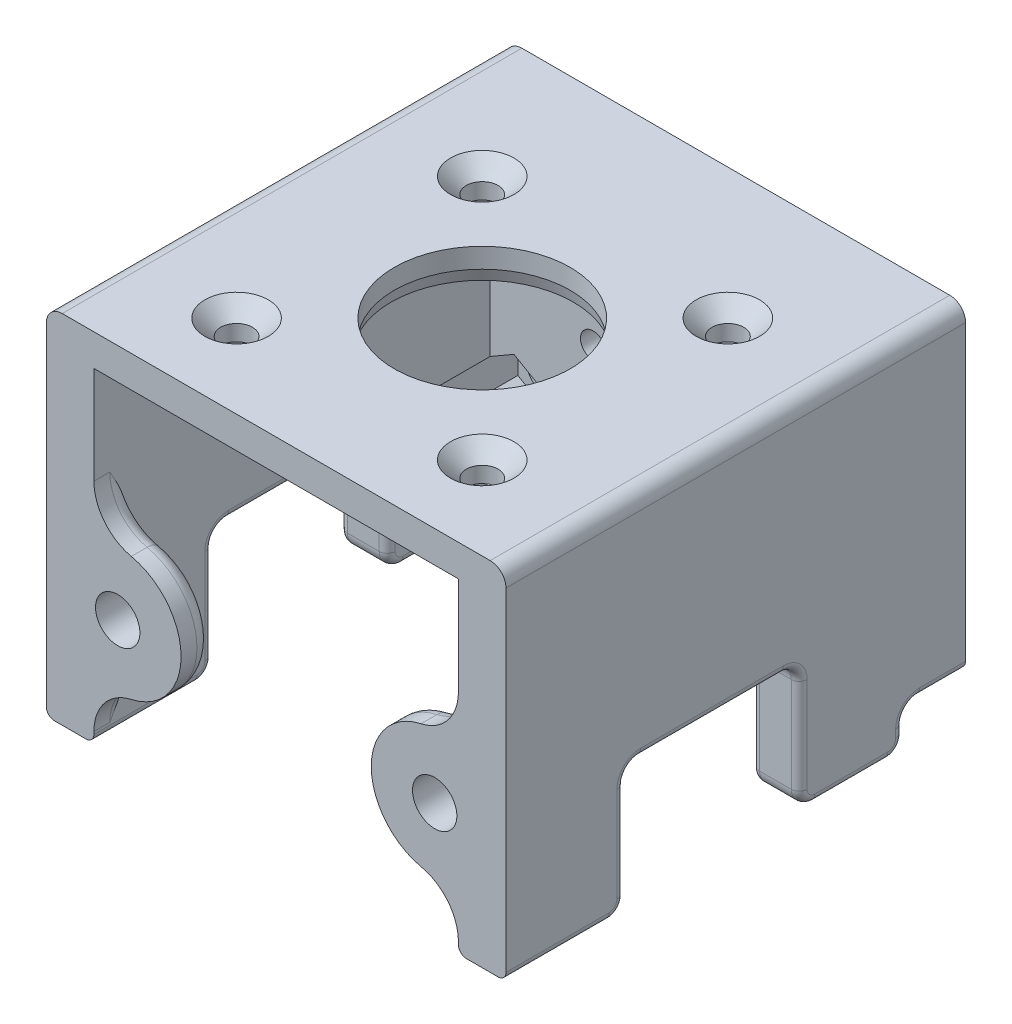
from build123d import *
from OCP.BRepFilletAPI import BRepFilletAPI_MakeChamfer

# Parameters (mm, degrees)
SKIZZE1_W                            = 58
SKIZZE1_H                            = 40
SKIZZE1_R                            = 2.4
SKIZZE1_R_2                          = 1.6
AUFSATZ_LINEAR_AUSTRAGEN1_DEPTH      = 8
AUFSATZ_LINEAR_AUSTRAGEN2_DEPTH      = 50
SKIZZE5_R                            = 11.1
SKIZZE5_R_2                          = 2
SCHNITT_LINEAR_AUSTRAGEN1_DEPTH      = 8
FASE1_SIZE                           = 2
SCHNITT_LINEAR_AUSTRAGEN6_DEPTH      = 10
SCHNITT_LINEAR_AUSTRAGEN6_DEPTH_BACK = 4
SKIZZE10_R                           = 8
SKIZZE10_R_2                         = 2.8
AUFSATZ_LINEAR_AUSTRAGEN3_DEPTH      = 4
SKIZZE13_W                           = 6
SKIZZE13_H                           = 50.174433159
AUFSATZ_LINEAR_AUSTRAGEN4_DEPTH      = 5
VERRUNDUNG1_R                        = 6
VERRUNDUNG3_R                        = 2
SKIZZE11_R                           = 2.8
SCHNITT_LINEAR_AUSTRAGEN7_DEPTH      = 4
FASE3_SIZE                           = 0.4
FASE3_SIZE2                          = 1.492820323
SKIZZE7_R                            = 2.4
SCHNITT_LINEAR_AUSTRAGEN2_DEPTH      = 18
VERRUNDUNG4_R                        = 2
SKIZZE12_W                           = 58
SKIZZE12_H                           = 22
SCHNITT_LINEAR_AUSTRAGEN8_DEPTH      = 16
VERRUNDUNG5_R                        = 2
FASE4_SIZE                           = 4.5
FASE4_SIZE2                          = 1.205771366
LINEARES_MUSTER1_COUNT               = 2
LINEARES_MUSTER1_PITCH               = 52
VERRUNDUNG6_R                        = 1


# Read off the part's stored shape, not the designer's step: Aufsatz-Linear austragen2
with BuildPart() as part:
    # Skizze1 → Aufsatz-Linear austragen1 (new body)
    with BuildSketch(Plane.XY):
        with Locations((0, -20)):
            Rectangle(SKIZZE1_W, SKIZZE1_H)
        with Locations((-20, -10)):
            Circle(SKIZZE1_R, mode=Mode.SUBTRACT)
        with Locations((0, -10)):
            Circle(SKIZZE1_R, mode=Mode.SUBTRACT)
        with Locations((20, -10)):
            Circle(SKIZZE1_R, mode=Mode.SUBTRACT)
        with Locations((0, -30)):
            Circle(SKIZZE1_R, mode=Mode.SUBTRACT)
        with Locations((20, -30)):
            Circle(SKIZZE1_R, mode=Mode.SUBTRACT)
        with Locations((-20, -30)):
            Circle(SKIZZE1_R, mode=Mode.SUBTRACT)
        with Locations((-10, -20)):
            Circle(SKIZZE1_R_2, mode=Mode.SUBTRACT)
        with Locations((10, -20)):
            Circle(SKIZZE1_R_2, mode=Mode.SUBTRACT)
    extrude(amount=AUFSATZ_LINEAR_AUSTRAGEN1_DEPTH)

    # Aufsatz-Linear austragen2 outline → Aufsatz-Linear austragen2 (add)
    with BuildSketch(Plane.XY.offset(8)):
        Polygon((23, -40), (29, -40), (29, 0), (-29, 0), (-29, -40), (-23, -40), (-23, -4), (23, -4), align=None)
    extrude(amount=AUFSATZ_LINEAR_AUSTRAGEN2_DEPTH)

    # Skizze5 → Schnitt-Linear austragen1 (cut)
    with BuildSketch(Plane(origin=(0, 0, 0), x_dir=(1, 0, 0), z_dir=(0, 1, 0))):
        with Locations(Location((0, -32, 0), (0, 0, 180))):
            Circle(SKIZZE5_R)
        with Locations(Location((-15.5, -16.5, 0), (0, 0, 180))):
            Circle(SKIZZE5_R_2)
        with Locations(Location((15.5, -16.5, 0), (0, 0, 180))):
            Circle(SKIZZE5_R_2)
        with Locations(Location((15.5, -47.5, 0), (0, 0, 180))):
            Circle(SKIZZE5_R_2)
        with Locations(Location((-15.5, -47.5, 0), (0, 0, 180))):
            Circle(SKIZZE5_R_2)
    extrude(amount=-SCHNITT_LINEAR_AUSTRAGEN1_DEPTH, mode=Mode.SUBTRACT)

    # Fase1
    fase1_edges = [part.edges().sort_by_distance(p)[0] for p in [
        (-13.5, 0, 47.5),
        (17.5, 0, 47.5),
        (17.5, 0, 16.5),
        (-13.5, 0, 16.5),
    ]]
    chamfer(fase1_edges, length=FASE1_SIZE)

    # Skizze9 → Schnitt-Linear austragen6 (cut, two sides: drawn at the far end of the back side and taken through both)
    with BuildSketch(Plane.XY.offset(8).offset(-SCHNITT_LINEAR_AUSTRAGEN6_DEPTH_BACK)):
        Polygon((3.5, -7.979274058), (0, -5.958548116), (-3.5, -7.979274058), (-3.5, -12.020725942), (0, -14.041451884), (3.5, -12.020725942), align=None)
        Polygon((-16.5, -7.979274058), (-20, -5.958548116), (-23.5, -7.979274058), (-23.5, -12.020725942), (-20, -14.041451884), (-16.5, -12.020725942), align=None)
        Polygon((23.5, -7.979274058), (20, -5.958548116), (16.5, -7.979274058), (16.5, -12.020725942), (20, -14.041451884), (23.5, -12.020725942), align=None)
        Polygon((3.5, -27.979274058), (0, -25.958548116), (-3.5, -27.979274058), (-3.5, -32.020725942), (0, -34.041451884), (3.5, -32.020725942), align=None)
        Polygon((23.5, -27.979274058), (20, -25.958548116), (16.5, -27.979274058), (16.5, -32.020725942), (20, -34.041451884), (23.5, -32.020725942), align=None)
        Polygon((-16.5, -27.979274058), (-20, -25.958548116), (-23.5, -27.979274058), (-23.5, -32.020725942), (-20, -34.041451884), (-16.5, -32.020725942), align=None)
    extrude(amount=SCHNITT_LINEAR_AUSTRAGEN6_DEPTH + SCHNITT_LINEAR_AUSTRAGEN6_DEPTH_BACK, mode=Mode.SUBTRACT)

    # Skizze10 → Aufsatz-Linear austragen3 (add)
    # profile 1 of 2: a face of its own
    with BuildSketch(Plane.XY.offset(58)):
        with Locations((20, -30)):
            Circle(SKIZZE10_R)
    # profile 2 of 2: a face of its own
    with BuildSketch(Plane.XY.offset(58)):
        with Locations((-20, -30)):
            Circle(SKIZZE10_R)
        with Locations((-20, -30)):
            Circle(SKIZZE10_R_2, mode=Mode.SUBTRACT)
    extrude(amount=-AUFSATZ_LINEAR_AUSTRAGEN3_DEPTH)

    # Skizze13 → Aufsatz-Linear austragen4 (add)
    with BuildSketch(Plane.XZ.offset(40)):
        with Locations((-26, 32.912783421)):
            Rectangle(SKIZZE13_W, SKIZZE13_H)
        with Locations((26, 32.912783421)):
            Rectangle(SKIZZE13_W, SKIZZE13_H)
    extrude(amount=AUFSATZ_LINEAR_AUSTRAGEN4_DEPTH)

    # Verrundung1
    verrundung1_edges = [part.edges().sort_by_distance(p)[0] for p in [
        (23, -37.416198487, 56),
        (23, -22.583801513, 56),
        (-23, -37.416198487, 56),
        (-23, -22.583801513, 56),
    ]]
    fillet(verrundung1_edges, radius=VERRUNDUNG1_R)

    # Verrundung3
    # the kernel refuses this fillet: 2 mm, written as the material it takes off along each edge
    with BuildSketch(Plane(origin=(-20, -30, 54), x_dir=(0.21428571428571433, -0.9767710236555245, 0), z_dir=(-0.9767710236555245, -0.21428571428571433, 0))) as verrundung3_piece_1:
        with BuildLine():
            CenterArc((8 - VERRUNDUNG3_R, VERRUNDUNG3_R), VERRUNDUNG3_R, 270, 90)
            Line((8 - VERRUNDUNG3_R, 0), (8, 0))
            Line((8, 0), (8, VERRUNDUNG3_R))
        make_face()
    revolve(axis=Axis((-20, -30, 54), (0, 0, 1)), revolution_arc=155.252749768, mode=Mode.SUBTRACT)
    with BuildSketch(Plane(origin=(20, -30, 54), x_dir=(-0.21428571428571433, 0.9767710236555245, 0), z_dir=(0.9767710236555245, 0.21428571428571433, 0))) as verrundung3_piece_2:
        with BuildLine():
            CenterArc((8 - VERRUNDUNG3_R, VERRUNDUNG3_R), VERRUNDUNG3_R, 270, 90)
            Line((8 - VERRUNDUNG3_R, 0), (8, 0))
            Line((8, 0), (8, VERRUNDUNG3_R))
        make_face()
    revolve(axis=Axis((20, -30, 54), (0, 0, 1)), revolution_arc=155.252749768, mode=Mode.SUBTRACT)
    with BuildSketch(Plane(origin=(-17, -16.325205669, 54), x_dir=(-0.6722279054593165, 0.7403442733767718, 0), z_dir=(0.7403442733767718, 0.6722279054593165, 0))) as verrundung3_piece_3_section:
        with BuildLine():
            CenterArc((6 + VERRUNDUNG3_R, VERRUNDUNG3_R), VERRUNDUNG3_R, 180, 90)
            Line((6 + VERRUNDUNG3_R, 0), (6, 0))
            Line((6, 0), (6, VERRUNDUNG3_R))
        make_face()
    verrundung3_piece_3 = revolve(axis=Axis((-17, -16.325205669, 54), (0, 0, 1)), revolution_arc=125.387125524, mode=Mode.PRIVATE)
    verrundung3_piece_3 = split(verrundung3_piece_3, bisect_by=Plane(origin=(-23, -20.355034942, 54.516064296), z_dir=(1, 0, 0)), keep=Keep.TOP, mode=Mode.PRIVATE)
    add(verrundung3_piece_3, mode=Mode.SUBTRACT)
    with BuildSketch(Plane(origin=(-17, -43.674794331, 54), x_dir=(-0.6722279054593165, -0.7403442733767718, 0), z_dir=(0.7403442733767718, -0.6722279054593165, 0))) as verrundung3_piece_4_section:
        with BuildLine():
            CenterArc((6 + VERRUNDUNG3_R, -VERRUNDUNG3_R), VERRUNDUNG3_R, 90, 90)
            Line((6, -VERRUNDUNG3_R), (6, 0))
            Line((6, 0), (6 + VERRUNDUNG3_R, 0))
        make_face()
    verrundung3_piece_4 = revolve(axis=Axis((-17, -43.674794331, 54), (0, 0, -1)), revolution_arc=125.387125524, mode=Mode.PRIVATE)
    verrundung3_piece_4 = split(verrundung3_piece_4, bisect_by=Plane(origin=(-23, -39.644965239, 54.51606418), z_dir=(1, 0, 0)), keep=Keep.TOP, mode=Mode.PRIVATE)
    add(verrundung3_piece_4, mode=Mode.SUBTRACT)
    with BuildSketch(Plane(origin=(17, -43.674794331, 54), x_dir=(0.6722279054593165, -0.7403442733767718, 0), z_dir=(-0.7403442733767718, -0.6722279054593165, 0))) as verrundung3_piece_5_section:
        with BuildLine():
            CenterArc((6 + VERRUNDUNG3_R, VERRUNDUNG3_R), VERRUNDUNG3_R, 180, 90)
            Line((6 + VERRUNDUNG3_R, 0), (6, 0))
            Line((6, 0), (6, VERRUNDUNG3_R))
        make_face()
    verrundung3_piece_5 = revolve(axis=Axis((17, -43.674794331, 54), (0, 0, 1)), revolution_arc=125.387125524, mode=Mode.PRIVATE)
    verrundung3_piece_5 = split(verrundung3_piece_5, bisect_by=Plane(origin=(23, -39.644963205, 54.516060737), z_dir=(-1, 0, 0)), keep=Keep.TOP, mode=Mode.PRIVATE)
    add(verrundung3_piece_5, mode=Mode.SUBTRACT)
    with BuildSketch(Plane(origin=(17, -16.325205669, 54), x_dir=(0.672227905459316, 0.7403442733767723, 0), z_dir=(-0.7403442733767723, 0.672227905459316, 0))) as verrundung3_piece_6_section:
        with BuildLine():
            CenterArc((6 + VERRUNDUNG3_R, -VERRUNDUNG3_R), VERRUNDUNG3_R, 90, 90)
            Line((6, -VERRUNDUNG3_R), (6, 0))
            Line((6, 0), (6 + VERRUNDUNG3_R, 0))
        make_face()
    verrundung3_piece_6 = revolve(axis=Axis((17, -16.325205669, 54), (0, 0, -1)), revolution_arc=125.387125524, mode=Mode.PRIVATE)
    verrundung3_piece_6 = split(verrundung3_piece_6, bisect_by=Plane(origin=(23, -20.355037546, 54.516064213), z_dir=(-1, 0, 0)), keep=Keep.TOP, mode=Mode.PRIVATE)
    add(verrundung3_piece_6, mode=Mode.SUBTRACT)

    # Skizze11 → Schnitt-Linear austragen7 (cut)
    with BuildSketch(Plane.XY.offset(58)):
        with Locations((20, -30)):
            Circle(SKIZZE11_R)
    extrude(amount=-SCHNITT_LINEAR_AUSTRAGEN7_DEPTH, mode=Mode.SUBTRACT)

    # Fase3
    fase3_edges = [part.edges().sort_by_distance(p)[0] for p in [
        (11.1, -4, 32),
    ]]
    fase3_side = [part.faces().sort_by_distance(p)[0] for p in [
        (-22.32058849, -4, 33),
    ]]
    chamfer(fase3_edges, length=FASE3_SIZE, length2=FASE3_SIZE2, reference=fase3_side[0])

    # Skizze7 → Schnitt-Linear austragen2 (cut)
    with BuildSketch(Plane.XZ.offset(45)):
        with Locations(Location((26, 15.300827002, 0), (0, 0, 270))):
            Circle(SKIZZE7_R)
        with Locations(Location((26, 50.800827002, 0), (0, 0, 270))):
            Circle(SKIZZE7_R)
    schnitt_linear_austragen2 = extrude(amount=-SCHNITT_LINEAR_AUSTRAGEN2_DEPTH, mode=Mode.SUBTRACT)

    # Verrundung4
    verrundung4_edges = [part.edges().sort_by_distance(p)[0] for p in [
        (-29, 0, 29),
        (29, 0, 29),
    ]]
    fillet(verrundung4_edges, radius=VERRUNDUNG4_R)

    # Skizze12 → Schnitt-Linear austragen8 (cut)
    with BuildSketch(Plane.XZ.offset(45)):
        with Locations((0, 32)):
            Rectangle(SKIZZE12_W, SKIZZE12_H)
    extrude(amount=-SCHNITT_LINEAR_AUSTRAGEN8_DEPTH, mode=Mode.SUBTRACT)

    # Verrundung5
    verrundung5_edges = [part.edges().sort_by_distance(p)[0] for p in [
        (-26, -40, 7.825566841),
        (-26, -45, 7.825566841),
        (26, -40, 7.825566841),
        (26, -45, 7.825566841),
        (26, -45, 21),
        (-26, -45, 21),
        (-26, -45, 43),
        (-26, -29, 43),
        (-26, -29, 21),
        (26, -29, 43),
        (26, -29, 21),
        (26, -45, 43),
    ]]
    fillet(verrundung5_edges, radius=VERRUNDUNG5_R)

    # Fase4: one chamfer whose edges measure the first distance from different faces: ONE call of the kernel's chamfer builder (chamfer() names one face for all edges)
    fase4_edges_1 = [part.edges().sort_by_distance(p)[0] for p in [
        (-11.6, -20, 0),
    ]]
    fase4_side_1 = [part.faces().sort_by_distance(p)[0] for p in [
        (-11.6, -20, 4),
    ]]
    fase4_edges_2 = [part.edges().sort_by_distance(p)[0] for p in [
        (8.4, -20, 0),
    ]]
    fase4_side_2 = [part.faces().sort_by_distance(p)[0] for p in [
        (8.4, -20, 4),
    ]]
    fase4 = BRepFilletAPI_MakeChamfer(part.part.solid().wrapped)
    for e in fase4_edges_1:
        fase4.Add(FASE4_SIZE, FASE4_SIZE2, e.wrapped, fase4_side_1[0].wrapped)  # the first distance lies on this face
    for e in fase4_edges_2:
        fase4.Add(FASE4_SIZE, FASE4_SIZE2, e.wrapped, fase4_side_2[0].wrapped)  # the first distance lies on this face
    add(Compound.cast(fase4.Shape()), mode=Mode.REPLACE)

    # Lineares Muster1: Schnitt-Linear austragen2 ×2
    with Locations(*[(-i * LINEARES_MUSTER1_PITCH, 0, 0) for i in range(1, LINEARES_MUSTER1_COUNT)]):
        add(schnitt_linear_austragen2, mode=Mode.SUBTRACT)

    # Verrundung6
    # the kernel refuses this fillet: 1 mm, written as the material it takes off along each edge
    with BuildSketch(Plane(origin=(-23, -42, 5.825566841), x_dir=(0, 0.3148458040869784, -0.9491428341660828), z_dir=(0, -0.9491428341660828, -0.3148458040869784))) as verrundung6_piece_1_section:
        with BuildLine():
            CenterArc((2 + VERRUNDUNG6_R, -VERRUNDUNG6_R), VERRUNDUNG6_R, 90, 90)
            Line((2, -VERRUNDUNG6_R), (2, 0))
            Line((2, 0), (2 + VERRUNDUNG6_R, 0))
        make_face()
    verrundung6_piece_1 = revolve(axis=Axis((-23, -42, 5.825566841), (1, 0, 0)), revolution_arc=161.648494619, mode=Mode.PRIVATE)
    verrundung6_piece_1 = split(verrundung6_piece_1, bisect_by=Plane(origin=(-23.272151062, -40, 7.287763131), z_dir=(0, -1, 0)), keep=Keep.TOP, mode=Mode.PRIVATE)
    add(verrundung6_piece_1, mode=Mode.SUBTRACT)
    with BuildSketch(Plane(origin=(-23, -42, 5.825566841), x_dir=(0, 0.3148458040869784, -0.9491428341660828), z_dir=(0, -0.9491428341660828, -0.3148458040869784))) as verrundung6_piece_2_section:
        with BuildLine():
            CenterArc((2 + VERRUNDUNG6_R, -VERRUNDUNG6_R), VERRUNDUNG6_R, 90, 90)
            Line((2, -VERRUNDUNG6_R), (2, 0))
            Line((2, 0), (2 + VERRUNDUNG6_R, 0))
        make_face()
    verrundung6_piece_2 = revolve(axis=Axis((-23, -42, 5.825566841), (1, 0, 0)), revolution_arc=161.648494619, mode=Mode.PRIVATE)
    verrundung6_piece_2 = split(verrundung6_piece_2, bisect_by=Plane(origin=(-23.00020869, -39.986552232, 8), z_dir=(0, 0, 1)), keep=Keep.TOP, mode=Mode.PRIVATE)
    add(verrundung6_piece_2, mode=Mode.SUBTRACT)
    with BuildSketch(Plane(origin=(-23, -42, 7.825566841), x_dir=(0, 0, 1), z_dir=(0, -1, 0)), Plane(origin=(29, -42, 7.825566841), x_dir=(0, 0, 1), z_dir=(0, -1, 0))) as verrundung6_piece_3:
        with BuildLine():
            CenterArc((VERRUNDUNG6_R, VERRUNDUNG6_R), VERRUNDUNG6_R, 180, 90)
            Line((0, VERRUNDUNG6_R), (0, 0))
            Line((0, 0), (VERRUNDUNG6_R, 0))
        make_face()
    extrude(amount=1, mode=Mode.SUBTRACT)
    with BuildSketch(Plane(origin=(-23, -43, 9.825566841), x_dir=(0, -1, 0), z_dir=(0, 0, 1))) as verrundung6_piece_4:
        with BuildLine():
            CenterArc((2 - VERRUNDUNG6_R, -VERRUNDUNG6_R), VERRUNDUNG6_R, 0, 90)
            Line((2, -VERRUNDUNG6_R), (2, 0))
            Line((2, 0), (2 - VERRUNDUNG6_R, 0))
        make_face()
    revolve(axis=Axis((-23, -43, 9.825566841), (1, 0, 0)), revolution_arc=90, mode=Mode.SUBTRACT)
    with BuildSketch(Plane(origin=(-23, -45, 9.825566841), x_dir=(0, 1, 0), z_dir=(0, 0, 1))) as verrundung6_piece_5:
        with BuildLine():
            CenterArc((VERRUNDUNG6_R, VERRUNDUNG6_R), VERRUNDUNG6_R, 180, 90)
            Line((0, VERRUNDUNG6_R), (0, 0))
            Line((0, 0), (VERRUNDUNG6_R, 0))
        make_face()
    extrude(amount=9.174433159, mode=Mode.SUBTRACT)
    with BuildSketch(Plane(origin=(-23, -43, 19), x_dir=(0, 0, 1), z_dir=(0, 1, 0))) as verrundung6_piece_6:
        with BuildLine():
            CenterArc((2 - VERRUNDUNG6_R, -VERRUNDUNG6_R), VERRUNDUNG6_R, 0, 90)
            Line((2, -VERRUNDUNG6_R), (2, 0))
            Line((2, 0), (2 - VERRUNDUNG6_R, 0))
        make_face()
    revolve(axis=Axis((-23, -43, 19), (1, 0, 0)), revolution_arc=90, mode=Mode.SUBTRACT)
    with BuildSketch(Plane(origin=(-23, -43, 21), x_dir=(0, 0, -1), z_dir=(0, 1, 0)), Plane(origin=(-23, -31, 43), x_dir=(0, 0, 1), z_dir=(0, -1, 0)), Plane(origin=(-29, -43, 43), x_dir=(0, 0, 1), z_dir=(0, 1, 0)), Plane(origin=(23, -31, 21), x_dir=(0, 0, -1), z_dir=(0, -1, 0)), Plane(origin=(23, -43, 43), x_dir=(0, 0, 1), z_dir=(0, 1, 0)), Plane(origin=(29, -43, 21), x_dir=(0, 0, -1), z_dir=(0, 1, 0))) as verrundung6_piece_7:
        with BuildLine():
            CenterArc((VERRUNDUNG6_R, VERRUNDUNG6_R), VERRUNDUNG6_R, 180, 90)
            Line((0, VERRUNDUNG6_R), (0, 0))
            Line((0, 0), (VERRUNDUNG6_R, 0))
        make_face()
    extrude(amount=12, mode=Mode.SUBTRACT)
    with BuildSketch(Plane(origin=(-23, -31, 23), x_dir=(0, 1, 0), z_dir=(0, 0, 1))) as verrundung6_piece_8:
        with BuildLine():
            CenterArc((2 + VERRUNDUNG6_R, VERRUNDUNG6_R), VERRUNDUNG6_R, 180, 90)
            Line((2, VERRUNDUNG6_R), (2, 0))
            Line((2, 0), (2 + VERRUNDUNG6_R, 0))
        make_face()
    revolve(axis=Axis((-23, -31, 23), (-1, 0, 0)), revolution_arc=90, mode=Mode.SUBTRACT)
    with BuildSketch(Plane(origin=(-23, -29, 41), x_dir=(0, 1, 0), z_dir=(0, 0, -1)), Plane(origin=(-29, -29, 23), x_dir=(0, 1, 0), z_dir=(0, 0, 1)), Plane(origin=(23, -29, 23), x_dir=(0, 1, 0), z_dir=(0, 0, 1)), Plane(origin=(29, -29, 41), x_dir=(0, 1, 0), z_dir=(0, 0, -1))) as verrundung6_piece_9:
        with BuildLine():
            CenterArc((VERRUNDUNG6_R, -VERRUNDUNG6_R), VERRUNDUNG6_R, 90, 90)
            Line((0, -VERRUNDUNG6_R), (0, 0))
            Line((0, 0), (VERRUNDUNG6_R, 0))
        make_face()
    extrude(amount=18, mode=Mode.SUBTRACT)
    with BuildSketch(Plane(origin=(-23, -31, 41), x_dir=(0, 0, 1), z_dir=(0, -1, 0))) as verrundung6_piece_10:
        with BuildLine():
            CenterArc((2 + VERRUNDUNG6_R, VERRUNDUNG6_R), VERRUNDUNG6_R, 180, 90)
            Line((2, VERRUNDUNG6_R), (2, 0))
            Line((2, 0), (2 + VERRUNDUNG6_R, 0))
        make_face()
    revolve(axis=Axis((-23, -31, 41), (-1, 0, 0)), revolution_arc=90, mode=Mode.SUBTRACT)
    with BuildSketch(Plane(origin=(-23, -43, 45), x_dir=(0, -1, 0), z_dir=(0, 0, 1))) as verrundung6_piece_11:
        with BuildLine():
            CenterArc((2 - VERRUNDUNG6_R, -VERRUNDUNG6_R), VERRUNDUNG6_R, 0, 90)
            Line((2, -VERRUNDUNG6_R), (2, 0))
            Line((2, 0), (2 - VERRUNDUNG6_R, 0))
        make_face()
    revolve(axis=Axis((-23, -43, 45), (1, 0, 0)), revolution_arc=90, mode=Mode.SUBTRACT)
    with BuildSketch(Plane(origin=(-29, -40, -2.5), x_dir=(1, 0, 0), z_dir=(0, 0, 1)), Plane(origin=(29, -40, 5.825566841), x_dir=(-1, 0, 0), z_dir=(0, 0, -1))) as verrundung6_piece_12:
        with BuildLine():
            CenterArc((VERRUNDUNG6_R, VERRUNDUNG6_R), VERRUNDUNG6_R, 180, 90)
            Line((0, VERRUNDUNG6_R), (0, 0))
            Line((0, 0), (VERRUNDUNG6_R, 0))
        make_face()
    extrude(amount=8.325566841, mode=Mode.SUBTRACT)
    with BuildSketch(Plane(origin=(-29, -42, 5.825566841), x_dir=(0, 1, 0), z_dir=(0, 0, -1))) as verrundung6_piece_13:
        with BuildLine():
            CenterArc((2 + VERRUNDUNG6_R, VERRUNDUNG6_R), VERRUNDUNG6_R, 180, 90)
            Line((2, VERRUNDUNG6_R), (2, 0))
            Line((2, 0), (2 + VERRUNDUNG6_R, 0))
        make_face()
    revolve(axis=Axis((-29, -42, 5.825566841), (1, 0, 0)), revolution_arc=90, mode=Mode.SUBTRACT)
    with BuildSketch(Plane(origin=(-29, -42, 7.825566841), x_dir=(0, 0, 1), z_dir=(0, -1, 0)), Plane(origin=(23, -42, 7.825566841), x_dir=(0, 0, 1), z_dir=(0, -1, 0))) as verrundung6_piece_14:
        with BuildLine():
            CenterArc((VERRUNDUNG6_R, -VERRUNDUNG6_R), VERRUNDUNG6_R, 90, 90)
            Line((0, -VERRUNDUNG6_R), (0, 0))
            Line((0, 0), (VERRUNDUNG6_R, 0))
        make_face()
    extrude(amount=1, mode=Mode.SUBTRACT)
    with BuildSketch(Plane(origin=(-29, -43, 9.825566841), x_dir=(0, -1, 0), z_dir=(0, 0, 1))) as verrundung6_piece_15:
        with BuildLine():
            CenterArc((2 - VERRUNDUNG6_R, VERRUNDUNG6_R), VERRUNDUNG6_R, 270, 90)
            Line((2, VERRUNDUNG6_R), (2, 0))
            Line((2, 0), (2 - VERRUNDUNG6_R, 0))
        make_face()
    revolve(axis=Axis((-29, -43, 9.825566841), (1, 0, 0)), revolution_arc=90, mode=Mode.SUBTRACT)
    with BuildSketch(Plane(origin=(-29, -45, 9.825566841), x_dir=(0, 1, 0), z_dir=(0, 0, 1)), Plane(origin=(23, -45, 9.825566841), x_dir=(0, 1, 0), z_dir=(0, 0, 1)), Plane(origin=(29, -45, 19), x_dir=(0, 1, 0), z_dir=(0, 0, -1))) as verrundung6_piece_16:
        with BuildLine():
            CenterArc((VERRUNDUNG6_R, -VERRUNDUNG6_R), VERRUNDUNG6_R, 90, 90)
            Line((0, -VERRUNDUNG6_R), (0, 0))
            Line((0, 0), (VERRUNDUNG6_R, 0))
        make_face()
    extrude(amount=9.174433159, mode=Mode.SUBTRACT)
    with BuildSketch(Plane(origin=(-29, -43, 19), x_dir=(0, 0, 1), z_dir=(0, 1, 0))) as verrundung6_piece_17:
        with BuildLine():
            CenterArc((2 - VERRUNDUNG6_R, VERRUNDUNG6_R), VERRUNDUNG6_R, 270, 90)
            Line((2, VERRUNDUNG6_R), (2, 0))
            Line((2, 0), (2 - VERRUNDUNG6_R, 0))
        make_face()
    revolve(axis=Axis((-29, -43, 19), (1, 0, 0)), revolution_arc=90, mode=Mode.SUBTRACT)
    with BuildSketch(Plane(origin=(-29, -43, 21), x_dir=(0, 0, -1), z_dir=(0, 1, 0)), Plane(origin=(29, -43, 43), x_dir=(0, 0, 1), z_dir=(0, 1, 0))) as verrundung6_piece_18:
        with BuildLine():
            CenterArc((VERRUNDUNG6_R, -VERRUNDUNG6_R), VERRUNDUNG6_R, 90, 90)
            Line((0, -VERRUNDUNG6_R), (0, 0))
            Line((0, 0), (VERRUNDUNG6_R, 0))
        make_face()
    extrude(amount=12, mode=Mode.SUBTRACT)
    with BuildSketch(Plane(origin=(-29, -31, 23), x_dir=(0, 1, 0), z_dir=(0, 0, 1))) as verrundung6_piece_19:
        with BuildLine():
            CenterArc((2 + VERRUNDUNG6_R, -VERRUNDUNG6_R), VERRUNDUNG6_R, 90, 90)
            Line((2, -VERRUNDUNG6_R), (2, 0))
            Line((2, 0), (2 + VERRUNDUNG6_R, 0))
        make_face()
    revolve(axis=Axis((-29, -31, 23), (-1, 0, 0)), revolution_arc=90, mode=Mode.SUBTRACT)
    with BuildSketch(Plane(origin=(-29, -31, 41), x_dir=(0, 0, 1), z_dir=(0, -1, 0))) as verrundung6_piece_20:
        with BuildLine():
            CenterArc((2 + VERRUNDUNG6_R, -VERRUNDUNG6_R), VERRUNDUNG6_R, 90, 90)
            Line((2, -VERRUNDUNG6_R), (2, 0))
            Line((2, 0), (2 + VERRUNDUNG6_R, 0))
        make_face()
    revolve(axis=Axis((-29, -31, 41), (-1, 0, 0)), revolution_arc=90, mode=Mode.SUBTRACT)
    with BuildSketch(Plane(origin=(-29, -43, 45), x_dir=(0, -1, 0), z_dir=(0, 0, 1))) as verrundung6_piece_21:
        with BuildLine():
            CenterArc((2 - VERRUNDUNG6_R, VERRUNDUNG6_R), VERRUNDUNG6_R, 270, 90)
            Line((2, VERRUNDUNG6_R), (2, 0))
            Line((2, 0), (2 - VERRUNDUNG6_R, 0))
        make_face()
    revolve(axis=Axis((-29, -43, 45), (1, 0, 0)), revolution_arc=90, mode=Mode.SUBTRACT)
    with BuildSketch(Plane(origin=(-23, -45, 45), x_dir=(0, 1, 0), z_dir=(0, 0, 1))) as verrundung6_piece_22:
        with BuildLine():
            CenterArc((VERRUNDUNG6_R, VERRUNDUNG6_R), VERRUNDUNG6_R, 180, 90)
            Line((0, VERRUNDUNG6_R), (0, 0))
            Line((0, 0), (VERRUNDUNG6_R, 0))
        make_face()
    extrude(amount=15.5, mode=Mode.SUBTRACT)
    with BuildSketch(Plane(origin=(-29, -45, 45), x_dir=(0, 1, 0), z_dir=(0, 0, 1)), Plane(origin=(23, -45, 45), x_dir=(0, 1, 0), z_dir=(0, 0, 1)), Plane(origin=(29, -45, 60.5), x_dir=(0, 1, 0), z_dir=(0, 0, -1))) as verrundung6_piece_23:
        with BuildLine():
            CenterArc((VERRUNDUNG6_R, -VERRUNDUNG6_R), VERRUNDUNG6_R, 90, 90)
            Line((0, -VERRUNDUNG6_R), (0, 0))
            Line((0, 0), (VERRUNDUNG6_R, 0))
        make_face()
    extrude(amount=15.5, mode=Mode.SUBTRACT)
    with BuildSketch(Plane(origin=(23, -42, 5.825566841), x_dir=(0, 0.3148458040869784, -0.9491428341660828), z_dir=(0, -0.9491428341660828, -0.3148458040869784))) as verrundung6_piece_24_section:
        with BuildLine():
            CenterArc((2 + VERRUNDUNG6_R, VERRUNDUNG6_R), VERRUNDUNG6_R, 180, 90)
            Line((2, VERRUNDUNG6_R), (2, 0))
            Line((2, 0), (2 + VERRUNDUNG6_R, 0))
        make_face()
    verrundung6_piece_24 = revolve(axis=Axis((23, -42, 5.825566841), (1, 0, 0)), revolution_arc=161.648494619, mode=Mode.PRIVATE)
    verrundung6_piece_24 = split(verrundung6_piece_24, bisect_by=Plane(origin=(23.272151116, -40, 7.287763135), z_dir=(0, -1, 0)), keep=Keep.TOP, mode=Mode.PRIVATE)
    add(verrundung6_piece_24, mode=Mode.SUBTRACT)
    with BuildSketch(Plane(origin=(23, -42, 5.825566841), x_dir=(0, 0.3148458040869784, -0.9491428341660828), z_dir=(0, -0.9491428341660828, -0.3148458040869784))) as verrundung6_piece_25_section:
        with BuildLine():
            CenterArc((2 + VERRUNDUNG6_R, VERRUNDUNG6_R), VERRUNDUNG6_R, 180, 90)
            Line((2, VERRUNDUNG6_R), (2, 0))
            Line((2, 0), (2 + VERRUNDUNG6_R, 0))
        make_face()
    verrundung6_piece_25 = revolve(axis=Axis((23, -42, 5.825566841), (1, 0, 0)), revolution_arc=161.648494619, mode=Mode.PRIVATE)
    verrundung6_piece_25 = split(verrundung6_piece_25, bisect_by=Plane(origin=(23.00020869, -39.986552232, 8), z_dir=(0, 0, 1)), keep=Keep.TOP, mode=Mode.PRIVATE)
    add(verrundung6_piece_25, mode=Mode.SUBTRACT)
    with BuildSketch(Plane(origin=(23, -43, 9.825566841), x_dir=(0, 0, -1), z_dir=(0, 1, 0))) as verrundung6_piece_26:
        with BuildLine():
            CenterArc((2 - VERRUNDUNG6_R, -VERRUNDUNG6_R), VERRUNDUNG6_R, 0, 90)
            Line((2, -VERRUNDUNG6_R), (2, 0))
            Line((2, 0), (2 - VERRUNDUNG6_R, 0))
        make_face()
    revolve(axis=Axis((23, -43, 9.825566841), (-1, 0, 0)), revolution_arc=90, mode=Mode.SUBTRACT)
    with BuildSketch(Plane(origin=(23, -43, 19), x_dir=(0, -1, 0), z_dir=(0, 0, -1))) as verrundung6_piece_27:
        with BuildLine():
            CenterArc((2 - VERRUNDUNG6_R, -VERRUNDUNG6_R), VERRUNDUNG6_R, 0, 90)
            Line((2, -VERRUNDUNG6_R), (2, 0))
            Line((2, 0), (2 - VERRUNDUNG6_R, 0))
        make_face()
    revolve(axis=Axis((23, -43, 19), (-1, 0, 0)), revolution_arc=90, mode=Mode.SUBTRACT)
    with BuildSketch(Plane(origin=(23, -31, 23), x_dir=(0, 0, -1), z_dir=(0, -1, 0))) as verrundung6_piece_28:
        with BuildLine():
            CenterArc((2 + VERRUNDUNG6_R, VERRUNDUNG6_R), VERRUNDUNG6_R, 180, 90)
            Line((2, VERRUNDUNG6_R), (2, 0))
            Line((2, 0), (2 + VERRUNDUNG6_R, 0))
        make_face()
    revolve(axis=Axis((23, -31, 23), (1, 0, 0)), revolution_arc=90, mode=Mode.SUBTRACT)
    with BuildSketch(Plane(origin=(23, -31, 41), x_dir=(0, 1, 0), z_dir=(0, 0, -1))) as verrundung6_piece_29:
        with BuildLine():
            CenterArc((2 + VERRUNDUNG6_R, VERRUNDUNG6_R), VERRUNDUNG6_R, 180, 90)
            Line((2, VERRUNDUNG6_R), (2, 0))
            Line((2, 0), (2 + VERRUNDUNG6_R, 0))
        make_face()
    revolve(axis=Axis((23, -31, 41), (1, 0, 0)), revolution_arc=90, mode=Mode.SUBTRACT)
    with BuildSketch(Plane(origin=(23, -43, 45), x_dir=(0, -1, 0), z_dir=(0, 0, 1))) as verrundung6_piece_30:
        with BuildLine():
            CenterArc((2 - VERRUNDUNG6_R, VERRUNDUNG6_R), VERRUNDUNG6_R, 270, 90)
            Line((2, VERRUNDUNG6_R), (2, 0))
            Line((2, 0), (2 - VERRUNDUNG6_R, 0))
        make_face()
    revolve(axis=Axis((23, -43, 45), (1, 0, 0)), revolution_arc=90, mode=Mode.SUBTRACT)
    with BuildSketch(Plane(origin=(29, -42, 5.825566841), x_dir=(0, 1, 0), z_dir=(0, 0, -1))) as verrundung6_piece_31:
        with BuildLine():
            CenterArc((2 + VERRUNDUNG6_R, -VERRUNDUNG6_R), VERRUNDUNG6_R, 90, 90)
            Line((2, -VERRUNDUNG6_R), (2, 0))
            Line((2, 0), (2 + VERRUNDUNG6_R, 0))
        make_face()
    revolve(axis=Axis((29, -42, 5.825566841), (1, 0, 0)), revolution_arc=90, mode=Mode.SUBTRACT)
    with BuildSketch(Plane(origin=(29, -43, 9.825566841), x_dir=(0, 0, -1), z_dir=(0, 1, 0))) as verrundung6_piece_32:
        with BuildLine():
            CenterArc((2 - VERRUNDUNG6_R, VERRUNDUNG6_R), VERRUNDUNG6_R, 270, 90)
            Line((2, VERRUNDUNG6_R), (2, 0))
            Line((2, 0), (2 - VERRUNDUNG6_R, 0))
        make_face()
    revolve(axis=Axis((29, -43, 9.825566841), (-1, 0, 0)), revolution_arc=90, mode=Mode.SUBTRACT)
    with BuildSketch(Plane(origin=(29, -43, 19), x_dir=(0, -1, 0), z_dir=(0, 0, -1))) as verrundung6_piece_33:
        with BuildLine():
            CenterArc((2 - VERRUNDUNG6_R, VERRUNDUNG6_R), VERRUNDUNG6_R, 270, 90)
            Line((2, VERRUNDUNG6_R), (2, 0))
            Line((2, 0), (2 - VERRUNDUNG6_R, 0))
        make_face()
    revolve(axis=Axis((29, -43, 19), (-1, 0, 0)), revolution_arc=90, mode=Mode.SUBTRACT)
    with BuildSketch(Plane(origin=(29, -31, 23), x_dir=(0, 0, -1), z_dir=(0, -1, 0))) as verrundung6_piece_34:
        with BuildLine():
            CenterArc((2 + VERRUNDUNG6_R, -VERRUNDUNG6_R), VERRUNDUNG6_R, 90, 90)
            Line((2, -VERRUNDUNG6_R), (2, 0))
            Line((2, 0), (2 + VERRUNDUNG6_R, 0))
        make_face()
    revolve(axis=Axis((29, -31, 23), (1, 0, 0)), revolution_arc=90, mode=Mode.SUBTRACT)
    with BuildSketch(Plane(origin=(29, -31, 41), x_dir=(0, 1, 0), z_dir=(0, 0, -1))) as verrundung6_piece_35:
        with BuildLine():
            CenterArc((2 + VERRUNDUNG6_R, -VERRUNDUNG6_R), VERRUNDUNG6_R, 90, 90)
            Line((2, -VERRUNDUNG6_R), (2, 0))
            Line((2, 0), (2 + VERRUNDUNG6_R, 0))
        make_face()
    revolve(axis=Axis((29, -31, 41), (1, 0, 0)), revolution_arc=90, mode=Mode.SUBTRACT)
    with BuildSketch(Plane(origin=(29, -43, 45), x_dir=(0, -1, 0), z_dir=(0, 0, 1))) as verrundung6_piece_36:
        with BuildLine():
            CenterArc((2 - VERRUNDUNG6_R, -VERRUNDUNG6_R), VERRUNDUNG6_R, 0, 90)
            Line((2, -VERRUNDUNG6_R), (2, 0))
            Line((2, 0), (2 - VERRUNDUNG6_R, 0))
        make_face()
    revolve(axis=Axis((29, -43, 45), (1, 0, 0)), revolution_arc=90, mode=Mode.SUBTRACT)


solid = part.part
